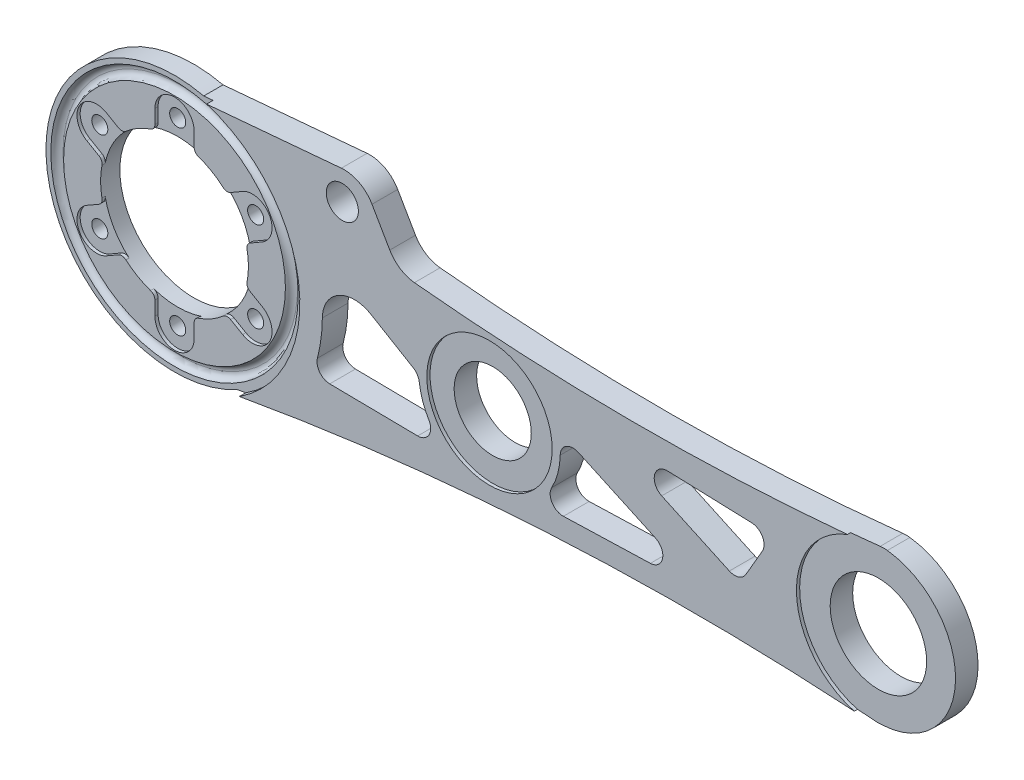
from build123d import *

# Parameters (mm, degrees)
SKETCH_1_R           = 11.5
EXTRUDE_1_DEPTH      = 3
SKETCH_2_R           = 6
CUT_EXTRUDE_1_DEPTH  = 10
SKETCH_3_R           = 7.5
CUT_EXTRUDE_2_DEPTH  = 10
SKETCH_5_R           = 1.25
CUT_EXTRUDE_4_DEPTH  = 10
SKETCH_9_W           = 9.785413343
SKETCH_9_H           = 10.582240284
EXTRUDE_4_DEPTH      = 3
EXTRUDE_6_DEPTH      = 3
SKETCH_13_R          = 400
CUT_EXTRUDE_6_DEPTH  = 10
EXTRUDE_7_DEPTH      = 3
SKETCH_15_R          = 2.5
CUT_EXTRUDE_7_DEPTH  = 10
EXTRUDE_START        = 1
SKETCH_19_R          = 9.75
SKETCH_19_R_2        = 2.5
EXTRUDE_8_DEPTH      = 1
FILLET_1_R           = 5
CUT_EXTRUDE_8_DEPTH  = 10
FILLET_2_R           = 2
FILLET_3_DEPTH       = 4
CUT_EXTRUDE_9_DEPTH  = 0.5
FILLET_5_R           = 1
SKETCH_21_R          = 20
SKETCH_21_R_2        = 17.05
EXTRUDE_9_DEPTH      = 3
EXTRUDE_START_2      = 0.1
SKETCH_23_R          = 20
SKETCH_23_R_2        = 17.05
EXTRUDE_10_DEPTH     = 0.1
SKETCH_22_R          = 19.25
SKETCH_22_R_2        = 17.25
CUT_EXTRUDE_14_DEPTH = 1
FILLET_7_R           = 1
SKETCH_24_R          = 20
CUT_EXTRUDE_15_DEPTH = 0.1
EXTRUDE_START_3      = 0.5
SKETCH_25_R          = 9.75
SKETCH_25_R_2        = 6
SKETCH_25_R_3        = 7.5
EXTRUDE_11_DEPTH     = 0.5


with BuildPart() as part:
    # 草图1 → 凸台-拉伸1 (new body)
    with BuildSketch(Plane.XY):
        with BuildLine():
            Line((1.209090909, 18.961489899), (110.763636364, 11.975677831))
            ThreePointArc((110.763636364, 11.975677831), (122, 0), (110.763636364, -11.975677831))
            Line((110.763636364, -11.975677831), (1.209090909, -18.961489899))
            ThreePointArc((1.209090909, -18.961489899), (-19, 0), (1.209090909, 18.961489899))
        make_face()
        Circle(SKETCH_1_R, mode=Mode.SUBTRACT)
    extrude(amount=EXTRUDE_1_DEPTH)

    # 草图2 → 切除-拉伸1 (cut)
    with BuildSketch(Plane(origin=(0, 0, 0), x_dir=(-1, 0, 0), z_dir=(0, 0, -1))):
        with Locations((-50, 0)):
            Circle(SKETCH_2_R)
    extrude(amount=-CUT_EXTRUDE_1_DEPTH, mode=Mode.SUBTRACT)

    # 草图3 → 切除-拉伸2 (cut)
    with BuildSketch(Plane(origin=(0, 0, 0), x_dir=(-1, 0, 0), z_dir=(0, 0, -1))):
        with Locations((-110, 0)):
            Circle(SKETCH_3_R)
    extrude(amount=-CUT_EXTRUDE_2_DEPTH, mode=Mode.SUBTRACT)

    # 草图5 → 切除-拉伸4 (cut)
    with BuildSketch(Plane(origin=(0, 0, 0), x_dir=(-1, 0, 0), z_dir=(0, 0, -1))):
        with Locations((0, 14)):
            Circle(SKETCH_5_R)
        with Locations((12.124355653, 7)):
            Circle(SKETCH_5_R)
        with Locations((12.124355653, -7)):
            Circle(SKETCH_5_R)
        with Locations((0, -14)):
            Circle(SKETCH_5_R)
        with Locations((-12.124355653, -7)):
            Circle(SKETCH_5_R)
        with Locations((-12.124355653, 7)):
            Circle(SKETCH_5_R)
    extrude(amount=-CUT_EXTRUDE_4_DEPTH, mode=Mode.SUBTRACT)

    # 草图9 → 凸台-拉伸4 (add, through all)
    with BuildSketch(Plane.XY.offset(3)):
        with Locations((26.618118247, 0)):
            Rectangle(SKETCH_9_W, SKETCH_9_H)
    extrude(amount=-EXTRUDE_4_DEPTH)

    # 草图12 → 凸台-拉伸6 (add)
    with BuildSketch(Plane.XY.offset(3)):
        Polygon((28.745410775, -6.403803536), (34.060824307, -16.874768539), (25.628100583, -16.874768539), (24.509066155, -9.241355121), align=None)
    extrude(amount=-EXTRUDE_6_DEPTH)

    # 草图13 → 切除-拉伸6 (cut)
    with BuildSketch(Plane.XY.offset(3)):
        with Locations((81.440909091, -411.008975968)):
            Circle(SKETCH_13_R)
        with BuildLine():
            Line((35.763636364, 11.975677831), (32.896967938, 16.940893192))
            Line((32.896967938, 16.940893192), (110.763636364, 11.975677831))
            ThreePointArc((110.763636364, 11.975677831), (73.263636364, 9.960950508), (35.763636364, 11.975677831))
        make_face()
    extrude(amount=-CUT_EXTRUDE_6_DEPTH, mode=Mode.SUBTRACT)

    # 草图16 → 凸台-拉伸7 (add)
    with BuildSketch(Plane.XY.offset(3)):
        Polygon((32.896967938, 16.940893192), (30.130621057, 21.732346541), (-1.669949201, 18.926470079), align=None)
    extrude(amount=-EXTRUDE_7_DEPTH)

    # 草图15 → 切除-拉伸7 (cut)
    with BuildSketch(Plane.XY.offset(3)):
        with Locations((27.103382326, 16.975677831)):
            Circle(SKETCH_15_R)
    extrude(amount=-CUT_EXTRUDE_7_DEPTH, mode=Mode.SUBTRACT)

    # 草图19 → 凸台-拉伸8 (add)
    with BuildSketch(Plane.XY.offset(3).offset(EXTRUDE_START)):
        with BuildLine():
            ThreePointArc((105.688354296, 11.466133233), (70.713238171, 9.970242818), (35.763636364, 11.975677831))
            Line((35.763636364, 11.975677831), (30.130621057, 21.732346541))
            Line((30.130621057, 21.732346541), (5.997664044, 19.603010637))
            ThreePointArc((5.997664044, 19.603010637), (20.307458553, 2.803056747), (11.083860146, -17.245232508))
            ThreePointArc((11.083860146, -17.245232508), (58.752317078, -11.652959621), (106.747426676, -11.810303416))
            ThreePointArc((106.747426676, -11.810303416), (97.762660496, -0.556796062), (105.688354296, 11.466133233))
        make_face()
        with Locations((50, 0)):
            Circle(SKETCH_19_R, mode=Mode.SUBTRACT)
        with Locations((27.103382326, 16.975677831)):
            Circle(SKETCH_19_R_2, mode=Mode.SUBTRACT)
    extrude(amount=-EXTRUDE_8_DEPTH)

    # 圆角1
    fillet_1_edges = [part.edges().sort_by_distance(p)[0] for p in [
        (35.763636364, 11.975677831, 2),
        (30.130621057, 21.732346541, 2),
        (110.763636364, 11.975677831, 1.5),
    ]]
    fillet(fillet_1_edges, radius=FILLET_1_R)

    # 草图4 → 切除-拉伸8 (cut)
    with BuildSketch(Plane(origin=(0, 0, 0), x_dir=(-1, 0, 0), z_dir=(0, 0, -1))):
        with BuildLine():
            Line((-22.718337944, 7.738030826), (-25.489112126, 7.658153323))
            Line((-25.489112126, 7.658153323), (-39.006073297, -0.365480019))
            ThreePointArc((-39.006073297, -0.365480019), (-40.223576833, -5.041978785), (-43.327845655, -8.745419166))
            Line((-43.327845655, -8.745419166), (-22.452972771, -8.477264519))
            ThreePointArc((-22.452972771, -8.477264519), (-23.996786842, -0.392710175), (-22.718337944, 7.738030826))
        make_face()
        with BuildLine():
            Line((-83.49595781, -7.485104525), (-57.207283211, -8.309937949))
            ThreePointArc((-57.207283211, -8.309937949), (-60.555711126, -3.094666805), (-60.553265828, 3.102995386))
            Line((-60.553265828, 3.102995386), (-83.49595781, -7.485104525))
        make_face()
        Polygon((-88.972134801, -3.404237943), (-67.80208643, 6.365783266), (-94.111121995, 5.483718321), align=None)
    extrude(amount=-CUT_EXTRUDE_8_DEPTH, mode=Mode.SUBTRACT)

    # 圆角2
    # the kernel refuses this fillet: 2 mm, written as the material it adds along each edge
    with BuildSketch(Plane(origin=(22.718337944, 7.738030826, 0), x_dir=(0.9995847151360328, -0.028816614416278277, 0), z_dir=(0, 0, 1))) as fillet_2_piece_1:
        with BuildLine():
            CenterArc((2.716749156, -2), FILLET_2_R, 90, 104.226121897)
            ThreePointArc((0.778082336, -2.491498686), (0.422937237, -1.235163774), (0, 0))
            Line((0, 0), (2.716749156, 0))
        make_face()
    extrude(amount=4)
    with BuildSketch(Plane(origin=(25.489112126, 7.658153323, 0), x_dir=(-0.9995847151360342, 0.028816614416228722, 0), z_dir=(0, 0, 1))) as fillet_2_piece_2:
        with BuildLine():
            CenterArc((FILLET_2_R * 0.259008280186, FILLET_2_R), FILLET_2_R, 240.958040197, 29.041959803)
            Line((-FILLET_2_R * 0.226441726119, FILLET_2_R * 0.12573557125), (0, 0))
            Line((0, 0), (FILLET_2_R * 0.259008280186, 0))
        make_face()
    extrude(amount=4)
    with BuildSketch(Plane(origin=(57.207283211, -8.309937949, 0), x_dir=(0.9995081364804766, 0.031360566151216684, 0), z_dir=(0, 0, 1))) as fillet_2_piece_3:
        with BuildLine():
            CenterArc((4.296733051, 2), FILLET_2_R, 149.837648672, 120.162351328)
            ThreePointArc((2.567522758, 3.004903858), (1.419830152, 1.386188751), (0, 0))
            Line((0, 0), (4.296733051, 0))
        make_face()
    extrude(amount=4)
    with BuildSketch(Plane(origin=(60.553265828, 3.102995386, 0), x_dir=(0.907971955307365, -0.4190309396396886, 0), z_dir=(0, 0, 1))) as fillet_2_piece_4:
        with BuildLine():
            CenterArc((3.615526985, -2), FILLET_2_R, 90, 113.768639436)
            ThreePointArc((1.785166166, -2.806088874), (0.999247071, -1.335187377), (0, 0))
            Line((0, 0), (3.615526985, 0))
        make_face()
    extrude(amount=4)
    with BuildSketch(Plane(origin=(83.49595781, -7.485104525, 0), x_dir=(-0.9079719553073375, 0.41903093963974836, 0), z_dir=(0, 0, 1))) as fillet_2_piece_5:
        with BuildLine():
            CenterArc((FILLET_2_R * 4.23516000471, FILLET_2_R), FILLET_2_R, 116.570544508, 153.429455492)
            Line((FILLET_2_R * 3.78786065654, FILLET_2_R * 1.89438430952), (0, 0))
            Line((0, 0), (FILLET_2_R * 4.23516000471, 0))
        make_face()
    extrude(amount=4)
    with BuildSketch(Plane(origin=(88.972134801, -3.404237943, 0), x_dir=(-0.9079719553073382, 0.41903093963974675, 0), z_dir=(0, 0, 1))) as fillet_2_piece_6:
        with BuildLine():
            CenterArc((FILLET_2_R * 0.912118784285, -FILLET_2_R), FILLET_2_R, 90, 84.737061388)
            Line((-FILLET_2_R * 0.0836654548784, -FILLET_2_R * 0.908273509635), (0, 0))
            Line((0, 0), (FILLET_2_R * 0.912118784285, 0))
        make_face()
    extrude(amount=4)
    with BuildSketch(Plane(origin=(94.111121995, 5.483718321, 0), x_dir=(-0.9994384410783521, 0.03350824517747174, 0), z_dir=(0, 0, 1))) as fillet_2_piece_7:
        with BuildLine():
            CenterArc((FILLET_2_R * 1.66810604239, FILLET_2_R), FILLET_2_R, 151.883880104, 118.116119896)
            Line((FILLET_2_R * 0.786111728241, FILLET_2_R * 1.47126004478), (0, 0))
            Line((0, 0), (FILLET_2_R * 1.66810604239, 0))
        make_face()
    extrude(amount=4)
    with BuildSketch(Plane(origin=(67.80208643, 6.365783266, 0), x_dir=(0.9079719553073374, -0.41903093963974836, 0), z_dir=(0, 0, 1))) as fillet_2_piece_8:
        with BuildLine():
            CenterArc((FILLET_2_R * 4.94759562481, FILLET_2_R), FILLET_2_R, 112.853181284, 157.146818716)
            Line((FILLET_2_R * 4.55922454262, FILLET_2_R * 1.92150306702), (0, 0))
            Line((0, 0), (FILLET_2_R * 4.94759562481, 0))
        make_face()
    extrude(amount=4)
    with BuildSketch(Plane(origin=(39.006073297, -0.365480019, 0), x_dir=(-0.8599123343159623, 0.5104417472065474, 0), z_dir=(0, 0, 1))) as fillet_2_piece_9:
        with BuildLine():
            CenterArc((1.037008755, 2), FILLET_2_R, 217.567480166, 52.432519834)
            ThreePointArc((-0.548262886, 0.780609241), (-0.265665753, 0.39625052), (0, 0))
            Line((0, 0), (1.037008755, 0))
        make_face()
    extrude(amount=4)
    with BuildSketch(Plane(origin=(22.452972771, -8.477264519, 0), x_dir=(0.9999175027948216, -0.01284475007806766, 0), z_dir=(0, 0, 1))) as fillet_2_piece_10:
        with BuildLine():
            CenterArc((2.692845423, 2), FILLET_2_R, 166.231102907, 103.768897093)
            ThreePointArc((0.750318174, 2.476012488), (0.408547652, 1.227888344), (0, 0))
            Line((0, 0), (2.692845423, 0))
        make_face()
    extrude(amount=4)
    with BuildSketch(Plane(origin=(43.327845655, -8.745419166, 0), x_dir=(-0.6666566833763927, 0.7453649217058637, 0), z_dir=(0, 0, 1))) as fillet_2_piece_11:
        with BuildLine():
            CenterArc((4.517437931, 1.964251261), FILLET_2_R, 137.454482312, 121.696210167)
            Line((3.043957146, 3.316602686), (0, 0))
            ThreePointArc((0, 0), (2.070492385, 0.196618063), (4.14098477, 0))
        make_face()
    extrude(amount=4)

    # 圆角3: read off the stored shape, not the designer's step
    # 圆角3 outline → 圆角3 (add)
    with BuildSketch(Plane.XY):
        with BuildLine():
            ThreePointArc((23.424300597, 5.225145123), (23.866306721, 2.529704233), (23.999179079, -0.198503227))
            ThreePointArc((23.999179079, -0.198503227), (26.543240849, 4.115507296), (31.55121679, 4.059703606))
            Line((31.55121679, 4.059703606), (25.934560956, 7.393736045))
            ThreePointArc((25.934560956, 7.393736045), (25.581112537, 7.559257609), (25.202247662, 7.652983694))
            ThreePointArc((25.202247662, 7.652983694), (23.762733827, 6.842234342), (23.424300597, 5.225145123))
        make_face()
    extrude(amount=FILLET_3_DEPTH)

    # 草图20 → 切除-拉伸9 (cut)
    with BuildSketch(Plane.XY.offset(3)):
        with BuildLine():
            Line((9.0877376, 1.724971107), (13.649355653, 4.358622518))
            ThreePointArc((13.649355653, 4.358622518), (14.765733135, 8.525), (10.599355653, 9.641377482))
            Line((10.599355653, 9.641377482), (6.0377376, 7.00772607))
            ThreePointArc((6.0377376, 7.00772607), (8.010734985, 4.625), (9.0877376, 1.724971107))
        make_face()
        with BuildLine():
            Line((6.0377376, -7.00772607), (10.599355653, -9.641377482))
            ThreePointArc((10.599355653, -9.641377482), (14.765733135, -8.525), (13.649355653, -4.358622518))
            Line((13.649355653, -4.358622518), (9.0877376, -1.724971107))
            ThreePointArc((9.0877376, -1.724971107), (8.010734985, -4.625), (6.0377376, -7.00772607))
        make_face()
        with BuildLine():
            Line((-3.05, -8.732697178), (-3.05, -14))
            ThreePointArc((-3.05, -14), (0, -17.05), (3.05, -14))
            Line((3.05, -14), (3.05, -8.732697178))
            ThreePointArc((3.05, -8.732697178), (0, -9.25), (-3.05, -8.732697178))
        make_face()
        with BuildLine():
            Line((-9.0877376, -1.724971107), (-13.649355653, -4.358622518))
            ThreePointArc((-13.649355653, -4.358622518), (-14.765733135, -8.525), (-10.599355653, -9.641377482))
            Line((-10.599355653, -9.641377482), (-6.0377376, -7.00772607))
            ThreePointArc((-6.0377376, -7.00772607), (-8.010734985, -4.625), (-9.0877376, -1.724971107))
        make_face()
        with BuildLine():
            Line((-6.0377376, 7.00772607), (-10.599355653, 9.641377482))
            ThreePointArc((-10.599355653, 9.641377482), (-14.765733135, 8.525), (-13.649355653, 4.358622518))
            Line((-13.649355653, 4.358622518), (-9.0877376, 1.724971107))
            ThreePointArc((-9.0877376, 1.724971107), (-8.010734985, 4.625), (-6.0377376, 7.00772607))
        make_face()
        with BuildLine():
            Line((3.05, 8.732697178), (3.05, 14))
            ThreePointArc((3.05, 14), (0, 17.05), (-3.05, 14))
            Line((-3.05, 14), (-3.05, 8.732697178))
            ThreePointArc((-3.05, 8.732697178), (0, 9.25), (3.05, 8.732697178))
        make_face()
    extrude(amount=-CUT_EXTRUDE_9_DEPTH, mode=Mode.SUBTRACT)

    # 圆角5
    fillet_5_edges = [part.edges().sort_by_distance(p)[0] for p in [
        (8.077636357, 8.185462167, 2.75),
        (11.127636357, 2.902707204, 2.75),
        (-3.05, 11.088169371, 2.75),
        (3.05, 11.088169371, 2.75),
        (-11.127636357, 2.902707204, 2.75),
        (-8.077636357, 8.185462167, 2.75),
        (-8.077636357, -8.185462167, 2.75),
        (-11.127636357, -2.902707204, 2.75),
        (3.05, -11.088169371, 2.75),
        (-3.05, -11.088169371, 2.75),
        (11.127636357, -2.902707204, 2.75),
        (8.077636357, -8.185462167, 2.75),
    ]]
    fillet(fillet_5_edges, radius=FILLET_5_R)

    # 草图21 → 凸台-拉伸9 (add)
    with BuildSketch(Plane.XY.offset(3)):
        Circle(SKETCH_21_R)
        Circle(SKETCH_21_R_2, mode=Mode.SUBTRACT)
    extrude(amount=-EXTRUDE_9_DEPTH)

    # 草图23 → 凸台-拉伸10 (add)
    with BuildSketch(Plane.XY.offset(3).offset(EXTRUDE_START_2)):
        Circle(SKETCH_23_R)
        with Locations(Location((0, 0, 0), (0, 0, 150))):
            Circle(SKETCH_23_R_2, mode=Mode.SUBTRACT)
    extrude(amount=-EXTRUDE_10_DEPTH)

    # 草图22 → 切除-拉伸14 (cut)
    with BuildSketch(Plane(origin=(0, 0, 3.1), x_dir=(-1, 0, 0), z_dir=(0, 0, -1))):
        Circle(SKETCH_22_R)
        Circle(SKETCH_22_R_2, mode=Mode.SUBTRACT)
    extrude(amount=CUT_EXTRUDE_14_DEPTH, mode=Mode.SUBTRACT)

    # 圆角7
    fillet_7_edges = [part.edges().sort_by_distance(p)[0] for p in [
        (19.25, 0, 2.1),
        (17.25, 0, 2.1),
    ]]
    fillet(fillet_7_edges, radius=FILLET_7_R - 0.0001)  # a hair under: the kernel refuses the full size

    # 草图24 → 切除-拉伸15 (cut)
    with BuildSketch(Plane.XY.offset(3.1)):
        Circle(SKETCH_24_R)
    extrude(amount=-CUT_EXTRUDE_15_DEPTH, mode=Mode.SUBTRACT)

    # 草图25 → 凸台-拉伸11 (add)
    # profile 1 of 2: a face of its own
    with BuildSketch(Plane.XY.offset(3).offset(EXTRUDE_START_3)):
        with Locations((50, 0)):
            Circle(SKETCH_25_R)
        with Locations(Location((50, 0, 0), (0, 0, 180))):
            Circle(SKETCH_25_R_2, mode=Mode.SUBTRACT)
    # profile 2 of 2: a face of its own
    with BuildSketch(Plane.XY.offset(3).offset(EXTRUDE_START_3)):
        with BuildLine():
            Line((109.959835226, -12.026932698), (110.763636364, -11.975677831))
            ThreePointArc((110.763636364, -11.975677831), (121.995805716, -0.317246321), (111.395554215, 11.918574933))
            ThreePointArc((111.395554215, 11.918574933), (110.840537707, 11.952432007), (110.285193899, 11.924452023))
            ThreePointArc((110.285193899, 11.924452023), (107.987530271, 11.687708366), (105.688354296, 11.466133233))
            ThreePointArc((105.688354296, 11.466133233), (97.762660496, -0.556796062), (106.747426676, -11.810303416))
            ThreePointArc((106.747426676, -11.810303416), (108.353848915, -11.915385854), (109.959835226, -12.026932698))
        make_face()
        with Locations(Location((110, 0, 0), (0, 0, 180))):
            Circle(SKETCH_25_R_3, mode=Mode.SUBTRACT)
    extrude(amount=-EXTRUDE_11_DEPTH)


solid = part.part
